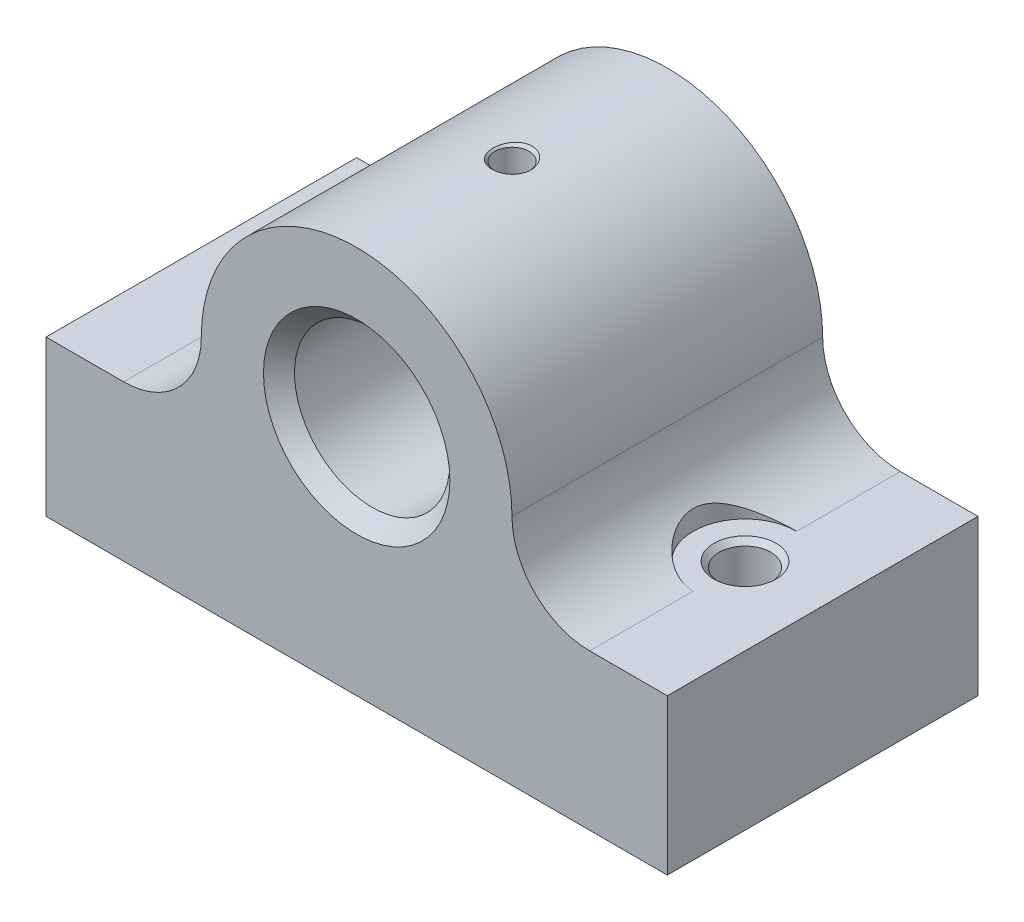
from build123d import *
from build123d.topology import SkipClean

# Parameters (mm, degrees)
SKETCH1_W                      = 120
SKETCH1_H                      = 60
BOSS_EXTRUDE1_DEPTH            = 30
SKETCH2_R                      = 30
BOSS_EXTRUDE2_DEPTH            = 60
FILLET1_R                      = 15
SKETCH3_R                      = 5
CUT_EXTRUDE2_DEPTH             = 81.777472107
SKETCH4_R                      = 10
CUT_EXTRUDE3_DEPTH             = 22
CHAMFER1_SIZE                  = 1
SKETCH5_R                      = 15
CUT_EXTRUDE4_DEPTH             = 114.247516582
CHAMFER3_SIZE                  = 3
G1_16_TAPPED_HOLE2_D           = 6.6
G1_16_TAPPED_HOLE2_DEPTH       = 29.999
G1_16_TAPPED_HOLE2_CSINK_D     = 7.773
G1_16_TAPPED_HOLE2_CSINK_ANGLE = 90
G1_16_TAPPED_HOLE2_TIP         = 1.982840043


# Read off the part's stored shape, not the designer's step: Mirror1
with BuildPart() as part:
    # Sketch1 → Boss-Extrude1 (new body)
    with BuildSketch(Plane(origin=(0, 0, 0), x_dir=(1, 0, 0), z_dir=(0, 1, 0))):
        Rectangle(SKETCH1_W, SKETCH1_H)
    extrude(amount=BOSS_EXTRUDE1_DEPTH)

    # Sketch2 → Boss-Extrude2 (add)
    with BuildSketch(Plane.XY.offset(30)):
        with Locations((0, 45)):
            Circle(SKETCH2_R)
    extrude(amount=-BOSS_EXTRUDE2_DEPTH)

    # Fillet1
    fillet1_edges = [part.edges().sort_by_distance(p)[0] for p in [
        (-25.980762114, 30, 0),
    ]]
    fillet(fillet1_edges, radius=FILLET1_R)

    # Sketch3 → Cut-Extrude2 (cut, symmetric)
    with BuildSketch(Plane(origin=(0, 30, 0), x_dir=(1, 0, 0), z_dir=(0, 1, 0))):
        with Locations(Location((-45, 0, 0), (0, 0, 270))):
            Circle(SKETCH3_R)
    extrude(amount=CUT_EXTRUDE2_DEPTH, both=True, mode=Mode.SUBTRACT)

    # Sketch4 → Cut-Extrude3 (cut)
    with BuildSketch(Plane(origin=(0, 30, 0), x_dir=(1, 0, 0), z_dir=(0, 1, 0))):
        with Locations((-45, 0)):
            Circle(SKETCH4_R)
    extrude(amount=CUT_EXTRUDE3_DEPTH, mode=Mode.SUBTRACT)

    # Chamfer1
    chamfer1_edges = [part.edges().sort_by_distance(p)[0] for p in [
        (-45, 30, -5),
    ]]
    chamfer(chamfer1_edges, length=CHAMFER1_SIZE)

    # Sketch5 → Cut-Extrude4 (cut, through all)
    with BuildSketch(Plane.XY.offset(30)):
        with Locations((0, 45)):
            Circle(SKETCH5_R)
    extrude(amount=-CUT_EXTRUDE4_DEPTH, mode=Mode.SUBTRACT)

    # Chamfer3
    chamfer3_edges = [part.edges().sort_by_distance(p)[0] for p in [
        (-15, 45, -30),
        (-15, 45, 30),
    ]]
    chamfer(chamfer3_edges, length=CHAMFER3_SIZE)

    # Mirror1
    split(bisect_by=Plane(origin=(0, 0, 0), x_dir=(0, 0, 1), z_dir=(1, 0, 0)), keep=Keep.BOTTOM)

    # Mirror1 2: part across plane


with BuildPart() as part_1:
    with SkipClean():  # the faces are left unmerged after this step: merging them gives an invalid solid
        add(part.part)
        add(part.part.mirror(Plane(origin=(0, 0, 0), x_dir=(0, 0, 1), z_dir=(1, 0, 0))))

    # G1/16 Tapped Hole2
    with Locations(Plane(origin=(0, 75, 0), x_dir=(1, 0, 0), z_dir=(0, 1, 0))):
        with Locations((0, 0)):
            CounterSinkHole(G1_16_TAPPED_HOLE2_D / 2, G1_16_TAPPED_HOLE2_CSINK_D / 2, depth=G1_16_TAPPED_HOLE2_DEPTH, counter_sink_angle=G1_16_TAPPED_HOLE2_CSINK_ANGLE)
            with Locations((0, 0, -(G1_16_TAPPED_HOLE2_DEPTH + G1_16_TAPPED_HOLE2_TIP / 2))):  # 118° drill point
                Cone(0, G1_16_TAPPED_HOLE2_D / 2, G1_16_TAPPED_HOLE2_TIP, mode=Mode.SUBTRACT)


solid = part_1.part
